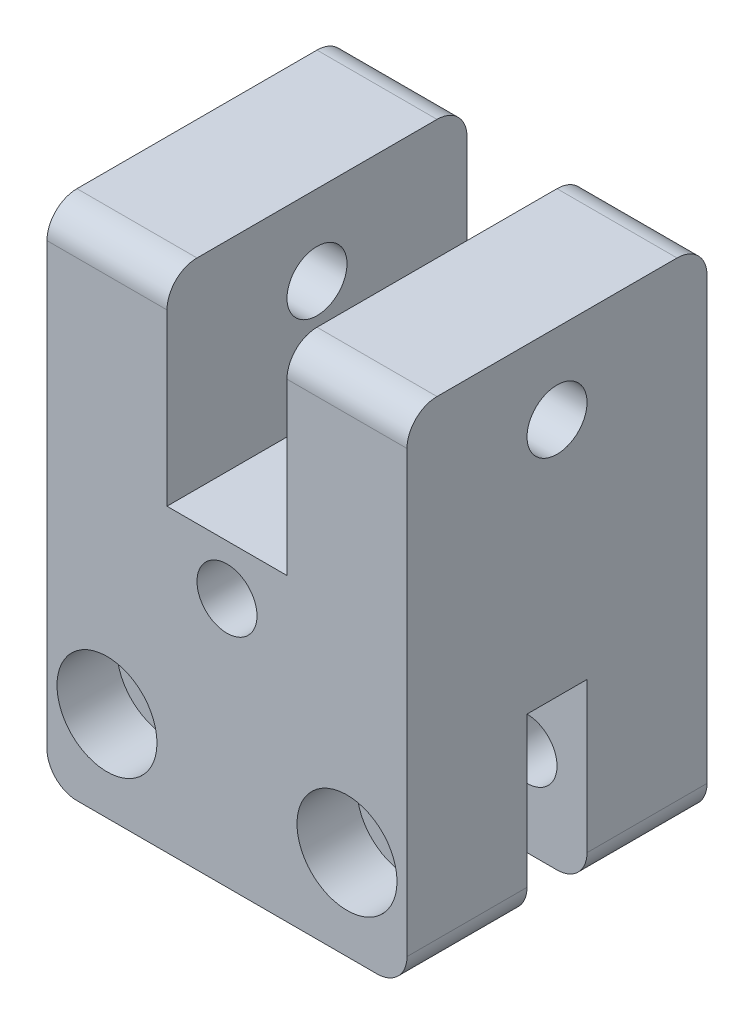
from build123d import *

# Parameters (mm, degrees)
CROQUIS2_W                 = 18
CROQUIS2_H                 = 15
SALIENTE_EXTRUIR1_DEPTH    = 7.5
CROQUIS3_W                 = 18
CROQUIS3_H                 = 9
CORTAR_EXTRUIR1_DEPTH      = 1.5
CORTAR_EXTRUIR2_DEPTH      = 14.910427743
CROQUIS10_W                = 6
CROQUIS10_H                = 15
SALIENTE_EXTRUIR4_DEPTH    = 10
CORTAR_EXTRUIR3_DEPTH      = 22.059439689
CORTAR_EXTRUIR3_DEPTH_BACK = 22.059439689
CROQUIS7_R                 = 1.5
CORTAR_EXTRUIR4_DEPTH      = 22.059439689
CORTAR_EXTRUIR4_DEPTH_BACK = 22.059439689
CROQUIS11_R                = 1.5
CROQUIS13_R                = 2.5
CORTAR_EXTRUIR5_DEPTH      = 3
CORTAR_EXTRUIR6_START      = -3
CROQUIS14_R                = 2.5
CORTAR_EXTRUIR6_DEPTH      = 3
REDONDEO2_R                = 1.5
REDONDEO3_R                = 1.5
CROQUIS15_R                = 1.5
CORTAR_EXTRUIR7_DEPTH      = 10


with BuildPart() as part:
    # Croquis2 → Saliente-Extruir1 (new, symmetric)
    with BuildSketch(Plane.XY):
        Rectangle(CROQUIS2_W, CROQUIS2_H)
    extrude(amount=SALIENTE_EXTRUIR1_DEPTH, both=True)

    # Croquis3 → Cortar-Extruir1 (cut, symmetric)
    with BuildSketch(Plane.XY):
        with Locations((0, -3)):
            Rectangle(CROQUIS3_W, CROQUIS3_H)
    extrude(amount=CORTAR_EXTRUIR1_DEPTH, both=True, mode=Mode.SUBTRACT)

    # Croquis4 → Cortar-Extruir2 (cut, through all)
    with BuildSketch(Plane.XY):
        with BuildLine():
            Line((-1.5, -3), (-1.5, -7.5))
            Line((-1.5, -7.5), (1.5, -7.5))
            Line((1.5, -7.5), (1.5, -3))
            ThreePointArc((1.5, -3), (0, -1.5), (-1.5, -3))
        make_face()
    extrude(amount=-CORTAR_EXTRUIR2_DEPTH, mode=Mode.SUBTRACT)

    # Croquis10 → Saliente-Extruir4 (add)
    with BuildSketch(Plane(origin=(0, 7.5, 0), x_dir=(1, 0, 0), z_dir=(0, 1, 0))):
        with Locations((-6, 0)):
            Rectangle(CROQUIS10_W, CROQUIS10_H)
        with Locations((6, 0)):
            Rectangle(CROQUIS10_W, CROQUIS10_H)
    extrude(amount=SALIENTE_EXTRUIR4_DEPTH)

    # Croquis7 → Cortar-Extruir3 (cut, two sides: drawn at the far end of the back side and taken through both)
    with BuildSketch(Plane(origin=(0, 0, 0), x_dir=(0, 0, -1), z_dir=(1, 0, 0)).offset(-CORTAR_EXTRUIR3_DEPTH_BACK)):
        with Locations((0, 13.5)):
            Circle(CROQUIS7_R)
    extrude(amount=CORTAR_EXTRUIR3_DEPTH + CORTAR_EXTRUIR3_DEPTH_BACK, mode=Mode.SUBTRACT)

    # Croquis11 → Cortar-Extruir4 (cut, two sides: drawn at the far end of the back side and taken through both)
    with BuildSketch(Plane.XY.offset(-CORTAR_EXTRUIR4_DEPTH_BACK)):
        with Locations((6, -3)):
            Circle(CROQUIS11_R)
        with Locations((-6, -3)):
            Circle(CROQUIS11_R)
    extrude(amount=CORTAR_EXTRUIR4_DEPTH + CORTAR_EXTRUIR4_DEPTH_BACK, mode=Mode.SUBTRACT)

    # Croquis13 → Cortar-Extruir5 (cut)
    with BuildSketch(Plane(origin=(0, 0, -7.5), x_dir=(-1, 0, 0), z_dir=(0, 0, -1))):
        with Locations((-6, -3)):
            Circle(CROQUIS13_R)
        with Locations((6, -3)):
            Circle(CROQUIS13_R)
    extrude(amount=-CORTAR_EXTRUIR5_DEPTH, mode=Mode.SUBTRACT)

    # Croquis14 → Cortar-Extruir6 (cut)
    with BuildSketch(Plane.XY.offset(7.5).offset(CORTAR_EXTRUIR6_START)):
        with Locations((-6, -3)):
            Circle(CROQUIS14_R)
        with Locations((6, -3)):
            Circle(CROQUIS14_R)
    extrude(amount=CORTAR_EXTRUIR6_DEPTH, mode=Mode.SUBTRACT)

    # Redondeo2
    redondeo2_edges = [part.edges().sort_by_distance(p)[0] for p in [
        (-6, 17.5, 7.5),
        (6, 17.5, 7.5),
        (-6, 17.5, -7.5),
        (6, 17.5, -7.5),
    ]]
    fillet(redondeo2_edges, radius=REDONDEO2_R)

    # Redondeo3
    redondeo3_edges = [part.edges().sort_by_distance(p)[0] for p in [
        (-9, -7.5, -4.5),
        (-9, -7.5, 4.5),
        (9, -7.5, -4.5),
        (9, -7.5, 4.5),
    ]]
    fillet(redondeo3_edges, radius=REDONDEO3_R)

    # Croquis15 → Cortar-Extruir7 (cut)
    with BuildSketch(Plane.XY.offset(7.5)):
        with Locations((0, 5)):
            Circle(CROQUIS15_R)
    extrude(amount=-CORTAR_EXTRUIR7_DEPTH, mode=Mode.SUBTRACT)


solid = part.part
